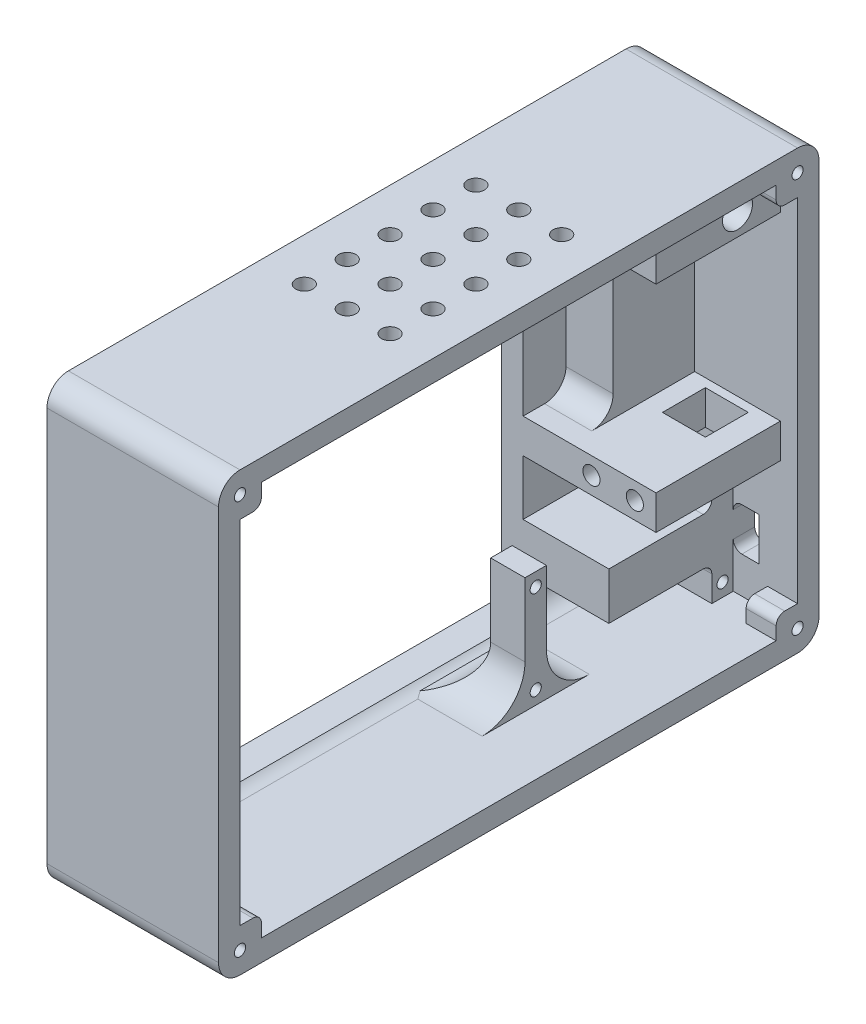
from build123d import *

# Parameters (mm, degrees)
SKETCH1_W                = 140
SKETCH1_H                = 102
BOSS_EXTRUDE1_DEPTH      = 40
SKETCH2_W                = 130
SKETCH2_H                = 92
CUT_EXTRUDE3_DEPTH       = 35
SKETCH4_W                = 90
SKETCH4_H                = 90
CUT_EXTRUDE4_DEPTH       = 35
FILLET1_R                = 5
SKETCH5_W                = 20
SKETCH5_H                = 10
SKETCH5_H_2              = 8
BOSS_EXTRUDE2_DEPTH      = 29
SKETCH6_R                = 2
CUT_EXTRUDE5_DEPTH       = 15
SKETCH7_W                = 5
SKETCH7_H                = 27
BOSS_EXTRUDE3_DEPTH      = 20
SKETCH8_R                = 1.3
CUT_EXTRUDE6_DEPTH       = 10
SKETCH9_W                = 29
SKETCH9_H                = 8
SKETCH9_H_2              = 10
BOSS_EXTRUDE4_DEPTH      = 16
SKETCH10_W               = 19
SKETCH10_H               = 42.14
BOSS_EXTRUDE5_DEPTH      = 11
SKETCH11_W               = 10
SKETCH11_H               = 10
CUT_EXTRUDE8_DEPTH       = 9
SKETCH12_W               = 24
SKETCH12_H               = 11
BOSS_EXTRUDE6_DEPTH      = 20
SKETCH14_W               = 8
SKETCH14_H               = 5
BOSS_EXTRUDE7_DEPTH      = 27
SKETCH15_R               = 1.3
CUT_EXTRUDE9_DEPTH       = 2.6
FILLET5_R                = 10
FILLET8_R                = 10
SKETCH16_W               = 6
SKETCH16_H               = 10
CUT_EXTRUDE10_DEPTH      = 13
FILLET12_R               = 2
FILLET13_R               = 2
SKETCH17_W               = 5
SKETCH17_H               = 5
BOSS_EXTRUDE8_DEPTH      = 35
SKETCH18_W               = 5
SKETCH18_H               = 5
BOSS_EXTRUDE9_DEPTH      = 4
SKETCH19_W               = 5
SKETCH19_H               = 5
BOSS_EXTRUDE10_DEPTH     = 7
FILLET14_R               = 2
FILLET15_R               = 2
FILLET16_R               = 2
FILLET17_R               = 2
SKETCH20_R               = 1.3
CUT_EXTRUDE11_DEPTH      = 7
CUT_EXTRUDE15_DEPTH      = 79
CUT_EXTRUDE15_DEPTH_BACK = 200
SKETCH21_R               = 2.5
FILLET18_START           = -130
FILLET18_DEPTH           = 120.060576923
FILLET18_2_DEPTH         = 24
FILLET18_START_2         = -16
FILLET18_3_DEPTH         = 11
FILLET18_START_3         = 5
FILLET18_4_OUTLINE_R     = 2.5
FILLET18_4_DEPTH         = 2
SKETCH22_R               = 3.5
CUT_EXTRUDE17_DEPTH      = 35
SKETCH29_W               = 1.5875
SKETCH29_H               = 3.297115384
SKETCH29_W_2             = 9.525
SKETCH29_H_2             = 1.709615385
CUT_EXTRUDE18_DEPTH      = 1.5
FILLET19_R               = 5
FILLET20_R               = 2
SKETCH30_R               = 2
CUT_EXTRUDE19_DEPTH      = 7


with BuildPart() as part:
    # Sketch1 → Boss-Extrude1 (new body)
    with BuildSketch(Plane(origin=(0, 0, 0), x_dir=(0, 0, -1), z_dir=(1, 0, 0))):
        with Locations((70, -51)):
            Rectangle(SKETCH1_W, SKETCH1_H)
    extrude(amount=BOSS_EXTRUDE1_DEPTH)

    # Sketch2 → Cut-Extrude3 (cut)
    with BuildSketch(Plane(origin=(40, 0, 0), x_dir=(0, 0, -1), z_dir=(1, 0, 0))):
        with Locations((70, -51)):
            Rectangle(SKETCH2_W, SKETCH2_H)
    extrude(amount=-CUT_EXTRUDE3_DEPTH, mode=Mode.SUBTRACT)

    # Sketch4 → Cut-Extrude4 (cut)
    with BuildSketch(Plane(origin=(5, 0, 0), x_dir=(0, 0, -1), z_dir=(1, 0, 0))):
        with Locations((61, -51)):
            Rectangle(SKETCH4_W, SKETCH4_H)
    extrude(amount=-CUT_EXTRUDE4_DEPTH, mode=Mode.SUBTRACT)

    # Fillet1
    fillet1_edges = [part.edges().sort_by_distance(p)[0] for p in [
        (20, -102, 0),
        (20, 0, 0),
        (20, 0, -140),
        (20, -102, -140),
    ]]
    fillet(fillet1_edges, radius=FILLET1_R)

    # Sketch5 → Boss-Extrude2 (add)
    with BuildSketch(Plane.XY.offset(-135)):
        with Locations((26, -10)):
            Rectangle(SKETCH5_W, SKETCH5_H)
        with Locations((26, -61.14)):
            Rectangle(SKETCH5_W, SKETCH5_H_2)
    extrude(amount=BOSS_EXTRUDE2_DEPTH)

    # Sketch6 → Cut-Extrude5 (cut)
    with BuildSketch(Plane.XY.offset(-106)):
        with Locations((31.06, -61.14)):
            Circle(SKETCH6_R)
        with Locations((20.94, -61.14)):
            Circle(SKETCH6_R)
        with Locations((31.06, -11)):
            Circle(SKETCH6_R)
        with Locations((20.94, -11)):
            Circle(SKETCH6_R)
    extrude(amount=-CUT_EXTRUDE5_DEPTH, mode=Mode.SUBTRACT)

    # Sketch7 → Boss-Extrude3 (add)
    with BuildSketch(Plane(origin=(5, 0, 0), x_dir=(0, 0, -1), z_dir=(1, 0, 0))):
        with Locations((132.5, -83.5)):
            Rectangle(SKETCH7_W, SKETCH7_H)
    extrude(amount=BOSS_EXTRUDE3_DEPTH)

    # Sketch8 → Cut-Extrude6 (cut)
    with BuildSketch(Plane(origin=(25, 0, 0), x_dir=(0, 0, -1), z_dir=(1, 0, 0))):
        with Locations((132.5, -93.895)):
            Circle(SKETCH8_R)
        with Locations((132.5, -73.105)):
            Circle(SKETCH8_R)
    extrude(amount=-CUT_EXTRUDE6_DEPTH, mode=Mode.SUBTRACT)

    # Sketch9 → Boss-Extrude4 (add)
    with BuildSketch(Plane.ZY.offset(-16)):
        with Locations((-120.5, -61.14)):
            Rectangle(SKETCH9_W, SKETCH9_H)
        with Locations((-120.5, -10)):
            Rectangle(SKETCH9_W, SKETCH9_H_2)
    extrude(amount=BOSS_EXTRUDE4_DEPTH)

    # Sketch10 → Boss-Extrude5 (add)
    with BuildSketch(Plane(origin=(5, 0, 0), x_dir=(0, 0, -1), z_dir=(1, 0, 0))):
        with Locations((125.5, -36.07)):
            Rectangle(SKETCH10_W, SKETCH10_H)
    extrude(amount=BOSS_EXTRUDE5_DEPTH)

    # Sketch11 → Cut-Extrude8 (cut)
    with BuildSketch(Plane(origin=(0, -57.14, 0), x_dir=(1, 0, 0), z_dir=(0, 1, 0))):
        with Locations((25.5, 128)):
            Rectangle(SKETCH11_W, SKETCH11_H)
    extrude(amount=-CUT_EXTRUDE8_DEPTH, mode=Mode.SUBTRACT)

    # Sketch12 → Boss-Extrude6 (add)
    with BuildSketch(Plane(origin=(5, 0, 0), x_dir=(0, 0, -1), z_dir=(1, 0, 0))):
        with Locations((118, -83.5)):
            Rectangle(SKETCH12_W, SKETCH12_H)
    extrude(amount=BOSS_EXTRUDE6_DEPTH)

    # Sketch14 → Boss-Extrude7 (add)
    with BuildSketch(Plane(origin=(0, -97, 0), x_dir=(1, 0, 0), z_dir=(0, 1, 0))):
        with Locations((21, 88.95)):
            Rectangle(SKETCH14_W, SKETCH14_H)
    extrude(amount=BOSS_EXTRUDE7_DEPTH)

    # Sketch15 → Cut-Extrude9 (cut)
    with BuildSketch(Plane(origin=(25, 0, 0), x_dir=(0, 0, -1), z_dir=(1, 0, 0))):
        with Locations((88.95, -93.89)):
            Circle(SKETCH15_R)
        with Locations((88.95, -73.1)):
            Circle(SKETCH15_R)
    extrude(amount=-CUT_EXTRUDE9_DEPTH, mode=Mode.SUBTRACT)

    # Fillet5
    fillet5_edges = [part.edges().sort_by_distance(p)[0] for p in [
        (21, -97, -86.45),
        (21, -97, -91.45),
    ]]
    fillet(fillet5_edges, radius=FILLET5_R)

    # Fillet8
    fillet8_edges = [part.edges().sort_by_distance(p)[0] for p in [
        (17, -97, -88.95),
    ]]
    fillet(fillet8_edges, radius=FILLET8_R)

    # Sketch16 → Cut-Extrude10 (cut)
    with BuildSketch(Plane.XY.offset(-135)):
        with Locations((28, -83.5)):
            Rectangle(SKETCH16_W, SKETCH16_H)
    extrude(amount=-CUT_EXTRUDE10_DEPTH, mode=Mode.SUBTRACT)

    # Fillet12
    fillet12_edges = [part.edges().sort_by_distance(p)[0] for p in [
        (25, -78.5, -137.5),
    ]]
    fillet(fillet12_edges, radius=FILLET12_R)

    # Fillet13
    fillet13_edges = [part.edges().sort_by_distance(p)[0] for p in [
        (25, -88.5, -137.5),
    ]]
    fillet(fillet13_edges, radius=FILLET13_R)

    # Sketch17 → Boss-Extrude8 (add)
    with BuildSketch(Plane(origin=(5, 0, 0), x_dir=(0, 0, -1), z_dir=(1, 0, 0))):
        with Locations((7.5, -94.5)):
            Rectangle(SKETCH17_W, SKETCH17_H)
        with Locations((7.5, -7.5)):
            Rectangle(SKETCH17_W, SKETCH17_H)
    extrude(amount=BOSS_EXTRUDE8_DEPTH)

    # Sketch18 → Boss-Extrude9 (add)
    with BuildSketch(Plane(origin=(36, 0, 0), x_dir=(0, 0, -1), z_dir=(1, 0, 0))):
        with Locations((132.5, -7.5)):
            Rectangle(SKETCH18_W, SKETCH18_H)
    extrude(amount=BOSS_EXTRUDE9_DEPTH)

    # Sketch19 → Boss-Extrude10 (add)
    with BuildSketch(Plane(origin=(40, 0, 0), x_dir=(0, 0, -1), z_dir=(1, 0, 0))):
        with Locations((132.5, -94.5)):
            Rectangle(SKETCH19_W, SKETCH19_H)
    extrude(amount=-BOSS_EXTRUDE10_DEPTH)

    # Fillet14
    fillet14_edges = [part.edges().sort_by_distance(p)[0] for p in [
        (22.5, -10, -10),
    ]]
    fillet(fillet14_edges, radius=FILLET14_R)

    # Fillet15
    fillet15_edges = [part.edges().sort_by_distance(p)[0] for p in [
        (22.5, -92, -10),
    ]]
    fillet(fillet15_edges, radius=FILLET15_R)

    # Fillet16
    fillet16_edges = [part.edges().sort_by_distance(p)[0] for p in [
        (36.5, -92, -130),
    ]]
    fillet(fillet16_edges, radius=FILLET16_R)

    # Fillet17
    fillet17_edges = [part.edges().sort_by_distance(p)[0] for p in [
        (38, -10, -130),
    ]]
    fillet(fillet17_edges, radius=FILLET17_R)

    # Sketch20 → Cut-Extrude11 (cut)
    with BuildSketch(Plane(origin=(40, 0, 0), x_dir=(0, 0, -1), z_dir=(1, 0, 0))):
        with Locations((135, -97)):
            Circle(SKETCH20_R)
        with Locations((5, -97)):
            Circle(SKETCH20_R)
        with Locations((5, -5)):
            Circle(SKETCH20_R)
        with Locations((135, -5)):
            Circle(SKETCH20_R)
    extrude(amount=-CUT_EXTRUDE11_DEPTH, mode=Mode.SUBTRACT)

    # Sketch21 → Cut-Extrude15 (cut, two sides: drawn at the far end of the back side and taken through both)
    with BuildSketch(Plane(origin=(5, 0, 0), x_dir=(0, 0, -1), z_dir=(1, 0, 0)).offset(-CUT_EXTRUDE15_DEPTH_BACK)):
        with Locations(Location((10, -87, 0), (0, 0, 180))):
            Circle(SKETCH21_R)
        with Locations(Location((10, -15, 0), (0, 0, 180))):
            Circle(SKETCH21_R)
        with Locations(Location((125, -93, 0), (0, 0, 180))):
            Circle(SKETCH21_R)
        with Locations(Location((125, -10, 0), (0, 0, 180))):
            Circle(SKETCH21_R)
    extrude(amount=CUT_EXTRUDE15_DEPTH + CUT_EXTRUDE15_DEPTH_BACK, mode=Mode.SUBTRACT)

    # Fillet18: read off the stored shape, not the designer's step
    # Fillet18 outline → Fillet18 (add)
    with BuildSketch(Plane.XY.offset(FILLET18_START)):
        with BuildLine():
            Line((7, -96), (5, -96))
            Line((5, -96), (5, -97))
            Line((5, -97), (10, -97))
            ThreePointArc((10, -97), (8.41886117, -96.74341649), (7, -96))
        make_face()
        with BuildLine():
            Line((5, -6), (7, -6))
            ThreePointArc((7, -6), (8.41886117, -5.25658351), (10, -5))
            Line((10, -5), (5, -5))
            Line((5, -5), (5, -6))
        make_face()
    extrude(amount=FILLET18_DEPTH)

    # Fillet18 2 outline → Fillet18 2 (add)
    with BuildSketch(Plane.XY.offset(FILLET18_START)):
        with BuildLine():
            Line((5, -91.999999856), (5, -96))
            Line((5, -96), (7, -96))
            ThreePointArc((7, -96), (5.527864013, -94.236067913), (5, -91.999999856))
        make_face()
    extrude(amount=FILLET18_2_DEPTH)

    # Fillet18 3 outline → Fillet18 3 (add)
    with BuildSketch(Plane.XY.offset(FILLET18_START_2)):
        with BuildLine():
            Line((5, -91.999999856), (5, -96))
            Line((5, -96), (7, -96))
            ThreePointArc((7, -96), (5.527864013, -94.236067913), (5, -91.999999856))
        make_face()
        with BuildLine():
            Line((5, -6), (5, -10))
            ThreePointArc((5, -10), (5.527864045, -7.763932022), (7, -6))
            Line((7, -6), (5, -6))
        make_face()
    extrude(amount=FILLET18_3_DEPTH)

    # Fillet18 4 outline → Fillet18 4 (cut)
    with BuildSketch(Plane.YZ.offset(FILLET18_START_3)):
        with Locations((-93, -125)):
            Circle(FILLET18_4_OUTLINE_R)
    extrude(amount=FILLET18_4_DEPTH, mode=Mode.SUBTRACT)

    # Sketch22 → Cut-Extrude17 (cut)
    with BuildSketch(Plane(origin=(36, 0, 0), x_dir=(0, 0, -1), z_dir=(1, 0, 0))):
        with Locations((125, -10)):
            Circle(SKETCH22_R)
    extrude(amount=-CUT_EXTRUDE17_DEPTH, mode=Mode.SUBTRACT)

    # Sketch29 → Cut-Extrude18 (cut)
    # profile 1 of 8: a face of its own
    with BuildSketch(Plane(origin=(0, 0, -140), x_dir=(-1, 0, 0), z_dir=(0, 0, -1))):
        Polygon((-19.525, -81.900961538), (-19.525, -77.260576923), (-17.815384615, -77.260576923), (-17.815384615, -80.191346154), (-15.983653846, -80.191346154), (-15.983653846, -77.260576923), (-14.274038462, -77.260576923), (-14.274038462, -80.191346154), (-10, -80.191346154), (-10, -81.900961538), align=None)
    # profile 2 of 8: a face of its own
    with BuildSketch(Plane(origin=(0, 0, -140), x_dir=(-1, 0, 0), z_dir=(0, 0, -1))):
        Polygon((-19.525, -76.527884615), (-19.525, -71.399038462), (-17.815384615, -71.399038462), (-17.815384615, -73.108653846), (-10, -73.108653846), (-10, -74.818269231), (-17.815384615, -74.818269231), (-17.815384615, -76.527884615), align=None)
    # profile 3 of 8: a face of its own
    with BuildSketch(Plane(origin=(0, 0, -140), x_dir=(-1, 0, 0), z_dir=(0, 0, -1))):
        Polygon((-19.525, -70.055769231), (-19.525, -64.926923077), (-17.815384615, -64.926923077), (-17.815384615, -68.346153846), (-15.983653846, -68.346153846), (-15.983653846, -64.926923077), (-14.274038462, -64.926923077), (-14.274038462, -68.346153846), (-11.709615385, -68.346153846), (-11.709615385, -64.926923077), (-10, -64.926923077), (-10, -70.055769231), align=None)
    # profile 4 of 8: a face of its own
    with BuildSketch(Plane(origin=(0, 0, -140), x_dir=(-1, 0, 0), z_dir=(0, 0, -1))):
        with BuildLine():
            Line((-17.872626202, -54.669230769), (-16.67436899, -55.922821514))
            add(Edge.make_bspline(
                [(-16.67436899, -55.922821514), (-16.784343554, -56.02915139), (-16.99915833, -56.23684695), (-17.283239519, -56.571691774), (-17.520977609, -56.919028575), (-17.717182343, -57.275391434), (-17.8716123, -57.641477803), (-17.980811231, -58.018515448), (-18.048127749, -58.405953454), (-18.055771023, -58.668241448), (-18.059615385, -58.800165264)],
                knots=[0, 0, 0, 0, 1.115315123, 2.178559852, 3.196385012, 4.180486591, 5.141138664, 6.08807191, 7.038351522, 8, 8, 8, 8], degree=3))
            add(Edge.make_bspline(
                [(-18.059615385, -58.800165264), (-18.056569227, -58.910333514), (-18.050557971, -59.127738416), (-18.006383336, -59.446915621), (-17.931545797, -59.752340871), (-17.827522161, -60.044256486), (-17.696521522, -60.324105725), (-17.531863165, -60.589282698), (-17.33904276, -60.841212492), (-17.118397721, -61.076951516), (-16.875542978, -61.289772862), (-16.6197734, -61.481527918), (-16.346565041, -61.640357298), (-16.059902117, -61.770009542), (-15.759681113, -61.872178491), (-15.445917057, -61.944691894), (-15.117901525, -61.986706208), (-14.894910916, -61.992970267), (-14.781580529, -61.996153846)],
                knots=[0, 0, 0, 0, 1.035268443, 2.04298821, 3.02163646, 3.985902049, 4.951223231, 5.920091634, 6.913651787, 7.92868536, 8.949353712, 9.945284791, 10.92850487, 11.913014323, 12.897904816, 13.904240668, 14.934873455, 16, 16, 16, 16], degree=3))
            add(Edge.make_bspline(
                [(-14.781580529, -61.996153846), (-14.702040071, -61.995222107), (-14.545264194, -61.993385631), (-14.313938057, -61.973830729), (-14.089038525, -61.941265314), (-13.871106119, -61.895901467), (-13.659856275, -61.837748777), (-13.454794331, -61.770572397), (-13.258365238, -61.684771011), (-13.066891116, -61.590390618), (-12.88498114, -61.481808939), (-12.712515544, -61.362911668), (-12.549455726, -61.234794561), (-12.396381468, -61.095746599), (-12.255496379, -60.944016867), (-12.122964353, -60.783269867), (-12.000875941, -60.611908705), (-11.891175315, -60.429864697), (-11.788922703, -60.242646696), (-11.704247703, -60.046397787), (-11.62812897, -59.846607418), (-11.570865003, -59.639769114), (-11.521057391, -59.429526718), (-11.490638346, -59.212953742), (-11.46752389, -58.992105575), (-11.466100777, -58.842842711), (-11.465384615, -58.767728365)],
                knots=[0, 0, 0, 0, 1.103738238, 2.175490744, 3.219137561, 4.256155604, 5.262629953, 6.259184223, 7.247888397, 8.234817694, 9.220364322, 10.185094651, 11.140491148, 12.096499151, 13.05201798, 14.011605636, 14.986460005, 15.968997565, 16.960259839, 17.944382265, 18.933125845, 19.924977513, 20.920749559, 21.929466621, 22.958034467, 24, 24, 24, 24], degree=3))
            add(Edge.make_bspline(
                [(-11.465384615, -58.767728365), (-11.469055961, -58.640317349), (-11.4762692, -58.389987833), (-11.533087564, -58.02268089), (-11.6255557, -57.672109684), (-11.737905369, -57.393016889), (-11.846844305, -57.174229889), (-11.944775543, -57.006273682), (-12.057674665, -56.834436458), (-12.186010477, -56.658979913), (-12.329222213, -56.478885666), (-12.490108182, -56.297134032), (-12.663468081, -56.109130377), (-12.787194291, -55.985968757), (-12.85063101, -55.922821514)],
                knots=[0, 0, 0, 0, 1.404693586, 2.759857621, 4.088769373, 5.395275838, 6.0697462, 6.783214465, 7.53810233, 8.336454657, 9.18000028, 10.074808326, 11.012918585, 12, 12, 12, 12], degree=3))
            Line((-12.85063101, -55.922821514), (-11.57414363, -54.707391827))
            add(Edge.make_bspline(
                [(-11.57414363, -54.707391827), (-11.491655764, -54.792829992), (-11.33065709, -54.959587018), (-11.102053997, -55.211135363), (-10.896628705, -55.462367124), (-10.706925176, -55.707213066), (-10.538469936, -55.94968402), (-10.391094745, -56.189754273), (-10.261072271, -56.424706125), (-10.150595281, -56.659418425), (-10.056788843, -56.895351676), (-9.976027656, -57.138099264), (-9.907706598, -57.388403294), (-9.852580476, -57.647792507), (-9.808376769, -57.913847478), (-9.778539522, -58.18905813), (-9.758480934, -58.47167949), (-9.756678503, -58.663385937), (-9.755769231, -58.760096154)],
                knots=[0, 0, 0, 0, 1.244526981, 2.429050516, 3.560637417, 4.644440555, 5.67424972, 6.652764056, 7.595344123, 8.486817594, 9.369275933, 10.254498637, 11.166417451, 12.086725134, 13.032340136, 13.991389299, 14.986715468, 16, 16, 16, 16], degree=3))
            add(Edge.make_bspline(
                [(-9.755769231, -58.760096154), (-9.760297748, -58.937740844), (-9.769158798, -59.285342122), (-9.834813178, -59.794742732), (-9.944881588, -60.278659638), (-10.10054868, -60.738270119), (-10.299406095, -61.173428029), (-10.543195948, -61.584022041), (-10.831270528, -61.96939037), (-11.160253321, -62.326419997), (-11.523587198, -62.649370287), (-11.913708104, -62.934820944), (-12.332533342, -63.170945737), (-12.773875524, -63.367005242), (-13.239748667, -63.520321196), (-13.730656702, -63.628229636), (-14.246125629, -63.694775983), (-14.598202788, -63.702056248), (-14.777764423, -63.705769231)],
                knots=[0, 0, 0, 0, 1.078019885, 2.10938526, 3.111377082, 4.085535484, 5.04941344, 6.010039228, 6.978205633, 7.964457913, 8.951525778, 9.924444315, 10.892603023, 11.863865945, 12.85144698, 13.863884204, 14.910567087, 16, 16, 16, 16], degree=3))
            add(Edge.make_bspline(
                [(-14.777764423, -63.705769231), (-14.894875801, -63.704215769), (-15.126961929, -63.701137189), (-15.469421681, -63.668174364), (-15.802840379, -63.623402124), (-16.12436884, -63.549854649), (-16.437666903, -63.464352456), (-16.739962064, -63.354195565), (-17.032527702, -63.226215076), (-17.314994311, -63.080085117), (-17.584311626, -62.912715227), (-17.842197174, -62.7304939), (-18.085310323, -62.529001793), (-18.314653397, -62.310278264), (-18.532824101, -62.076344496), (-18.734456894, -61.823194069), (-18.924961107, -61.555144366), (-19.098655159, -61.27033856), (-19.256626912, -60.975266511), (-19.39253422, -60.671362011), (-19.509147668, -60.362542863), (-19.60515595, -60.047872683), (-19.677015049, -59.726795066), (-19.731357184, -59.401461435), (-19.76174626, -59.06914126), (-19.766720039, -58.8460157), (-19.769230769, -58.733383413)],
                knots=[0, 0, 0, 0, 1.071814294, 2.12407397, 3.147667899, 4.14936388, 5.141177959, 6.119239245, 7.091825145, 8.063277363, 9.028022524, 9.992609517, 10.952139039, 11.915934802, 12.892469547, 13.878248468, 14.87668965, 15.901326483, 16.93027266, 17.938917451, 18.9468897, 19.950817235, 20.948103127, 21.957084021, 22.968749718, 24, 24, 24, 24], degree=3))
            add(Edge.make_bspline(
                [(-19.769230769, -58.733383413), (-19.767790064, -58.637297065), (-19.764923633, -58.446123399), (-19.741071042, -58.161425883), (-19.70350443, -57.879036411), (-19.647220485, -57.59981731), (-19.579058036, -57.322512948), (-19.4951003, -57.048284325), (-19.392691539, -56.777887634), (-19.279405838, -56.50897875), (-19.150435949, -56.24692066), (-19.00607943, -55.993990827), (-18.850112785, -55.749562536), (-18.679853364, -55.515109281), (-18.497802055, -55.28897971), (-18.303964886, -55.071415098), (-18.094825699, -54.864503141), (-17.947067138, -54.734650621), (-17.872626202, -54.669230769)],
                knots=[0, 0, 0, 0, 0.996333415, 1.982307736, 2.96084097, 3.949129141, 4.93457382, 5.921430247, 6.92116383, 7.931890485, 8.946633814, 9.948019707, 10.950686436, 11.952094051, 12.951305284, 13.960287133, 14.972390273, 16, 16, 16, 16], degree=3))
        make_face()
    # profile 5 of 8: a face of its own
    with BuildSketch(Plane(origin=(0, 0, -140), x_dir=(-1, 0, 0), z_dir=(0, 0, -1))):
        Polygon((-19.525, -52.959615385), (-19.525, -51.25), (-15.861538462, -51.25), (-15.861538462, -47.952884615), (-19.525, -47.952884615), (-19.525, -46.243269231), (-10, -46.243269231), (-10, -47.952884615), (-14.151923077, -47.952884615), (-14.151923077, -51.25), (-10, -51.25), (-10, -52.959615385), align=None)
    # profile 6 of 8: a face of its own
    with BuildSketch(Plane(origin=(0, 0, -140), x_dir=(-1, 0, 0), z_dir=(0, 0, -1))):
        with Locations((-13.480288462, -38.733173077)):
            Rectangle(SKETCH29_W, SKETCH29_H)
    # profile 7 of 8: a face of its own
    with BuildSketch(Plane(origin=(0, 0, -140), x_dir=(-1, 0, 0), z_dir=(0, 0, -1))):
        Polygon((-19.525, -28.290399639), (-19.525, -26.704807692), (-10, -22.858173077), (-10, -24.684179688), (-11.953846154, -25.424504207), (-11.953846154, -29.574519231), (-10, -30.31484375), (-10, -32.138942308), align=None)
        Polygon((-16.970117188, -27.498557692), (-13.663461538, -28.92578125), (-13.663461538, -26.071334135), align=None, mode=Mode.SUBTRACT)
    # profile 8 of 8: a face of its own
    with BuildSketch(Plane(origin=(0, 0, -140), x_dir=(-1, 0, 0), z_dir=(0, 0, -1))):
        with Locations((-14.7625, -20.843269231)):
            Rectangle(SKETCH29_W_2, SKETCH29_H_2)
    extrude(amount=-CUT_EXTRUDE18_DEPTH, mode=Mode.SUBTRACT)

    # Fillet19
    fillet19_edges = [part.edges().sort_by_distance(p)[0] for p in [
        (10.5, -15, -116),
        (10.5, -57.14, -116),
    ]]
    fillet(fillet19_edges, radius=FILLET19_R)

    # Fillet20
    fillet20_edges = [part.edges().sort_by_distance(p)[0] for p in [
        (15, -89, -130),
        (15, -78, -130),
    ]]
    fillet(fillet20_edges, radius=FILLET20_R)

    # Sketch30 → Cut-Extrude19 (cut)
    with BuildSketch(Plane(origin=(0, 0, 0), x_dir=(1, 0, 0), z_dir=(0, 1, 0))):
        with Locations(Location((30, 90, 0), (0, 0, 270))):
            Circle(SKETCH30_R)
        with Locations(Location((20, 90, 0), (0, 0, 270))):
            Circle(SKETCH30_R)
        with Locations(Location((10, 90, 0), (0, 0, 270))):
            Circle(SKETCH30_R)
        with Locations(Location((10, 80, 0), (0, 0, 270))):
            Circle(SKETCH30_R)
        with Locations(Location((20, 80, 0), (0, 0, 270))):
            Circle(SKETCH30_R)
        with Locations(Location((30, 80, 0), (0, 0, 270))):
            Circle(SKETCH30_R)
        with Locations(Location((10, 70, 0), (0, 0, 270))):
            Circle(SKETCH30_R)
        with Locations(Location((20, 70, 0), (0, 0, 270))):
            Circle(SKETCH30_R)
        with Locations(Location((30, 70, 0), (0, 0, 270))):
            Circle(SKETCH30_R)
        with Locations(Location((30, 60, 0), (0, 0, 270))):
            Circle(SKETCH30_R)
        with Locations(Location((20, 60, 0), (0, 0, 270))):
            Circle(SKETCH30_R)
        with Locations(Location((10, 60, 0), (0, 0, 270))):
            Circle(SKETCH30_R)
        with Locations(Location((30, 50, 0), (0, 0, 270))):
            Circle(SKETCH30_R)
        with Locations(Location((20, 50, 0), (0, 0, 270))):
            Circle(SKETCH30_R)
        with Locations(Location((10, 50, 0), (0, 0, 270))):
            Circle(SKETCH30_R)
    extrude(amount=-CUT_EXTRUDE19_DEPTH, mode=Mode.SUBTRACT)


solid = part.part
